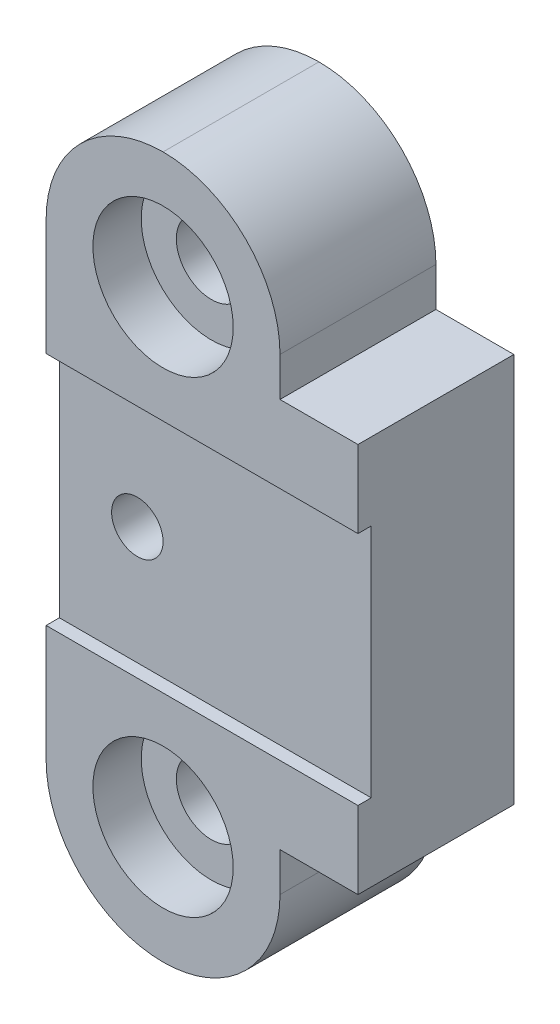
from build123d import *

# Parameters (mm, degrees)
AUFSATZ_LINEAR_AUSTRAGEN1_DEPTH                      = 10
SKIZZE2_W                                            = 20
SKIZZE2_H                                            = 15.1
SCHNITT_LINEAR_AUSTRAGEN1_DEPTH                      = 0.85
STIRNSENKUNG_F_R_M4_FLACHKOPFSCHRAUBE_MI_D           = 4.5
STIRNSENKUNG_F_R_M4_FLACHKOPFSCHRAUBE_MI_CBORE_D     = 9
STIRNSENKUNG_F_R_M4_FLACHKOPFSCHRAUBE_MI_CBORE_DEPTH = 3.1
M4_GEWINDEBOHRUNG1_D                                 = 3.3
VERRUNDUNG1_R                                        = 7.5


with BuildPart() as part:
    # Skizze1 → Aufsatz-Linear austragen1 (new body)
    with BuildSketch(Plane.XY):
        Polygon((0, 0), (0, 45), (15, 45), (15, 35), (20, 35), (20, 10), (15, 10), (15, 0), align=None)
    extrude(amount=AUFSATZ_LINEAR_AUSTRAGEN1_DEPTH)

    # Skizze2 → Schnitt-Linear austragen1 (cut)
    with BuildSketch(Plane.XY.offset(10)):
        with Locations((10, 22.5)):
            Rectangle(SKIZZE2_W, SKIZZE2_H)
    extrude(amount=-SCHNITT_LINEAR_AUSTRAGEN1_DEPTH, mode=Mode.SUBTRACT)

    # Stirnsenkung für M4 Flachkopfschraube mit Schlitz1 (through all)
    with Locations(Plane.XY.offset(10)):
        with Locations((7.5, 37.5), (7.5, 7.5)):
            CounterBoreHole(STIRNSENKUNG_F_R_M4_FLACHKOPFSCHRAUBE_MI_D / 2, STIRNSENKUNG_F_R_M4_FLACHKOPFSCHRAUBE_MI_CBORE_D / 2, STIRNSENKUNG_F_R_M4_FLACHKOPFSCHRAUBE_MI_CBORE_DEPTH)

    # M4 Gewindebohrung1 (through all)
    with Locations(Plane.XY.offset(9.15)):
        with Locations((5, 22.5)):
            Hole(M4_GEWINDEBOHRUNG1_D / 2)

    # Verrundung1
    verrundung1_edges = [part.edges().sort_by_distance(p)[0] for p in [
        (0, 0, 5),
        (15, 0, 5),
        (15, 45, 5),
        (0, 45, 5),
    ]]
    fillet(verrundung1_edges, radius=VERRUNDUNG1_R - 0.0001)  # a hair under: the kernel refuses the full size


solid = part.part
